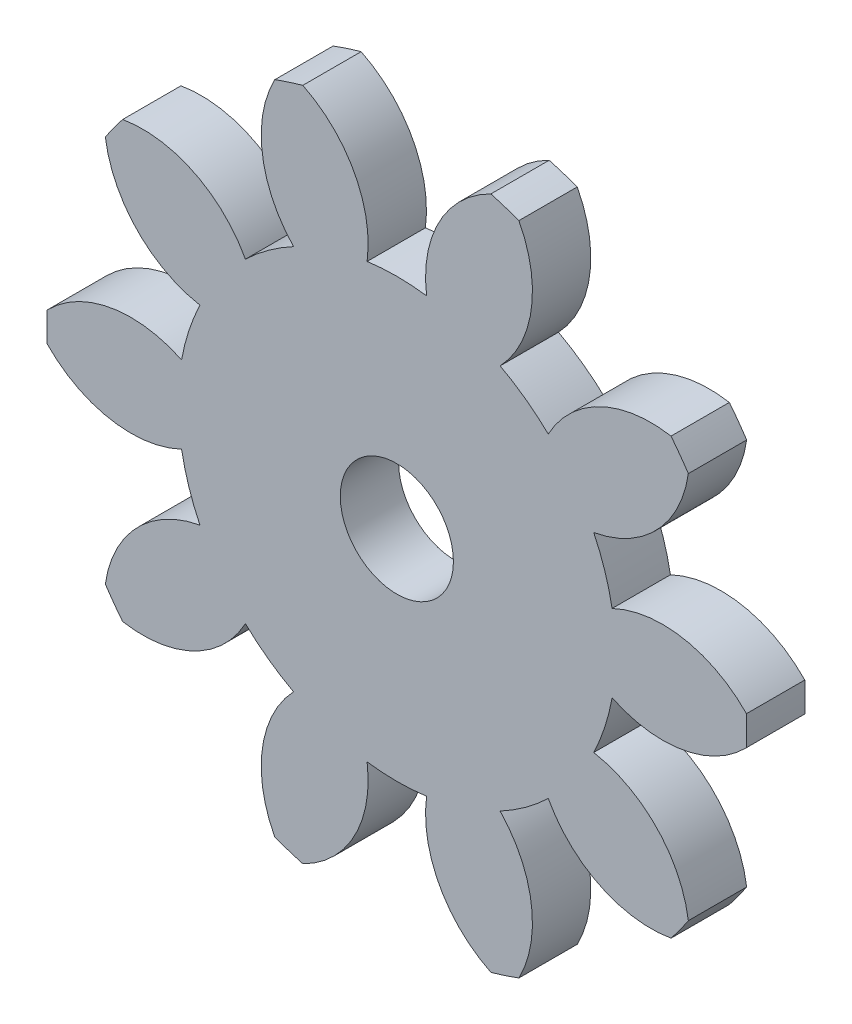
from build123d import *

# Parameters (mm, degrees)
SKETCH1_R           = 18
BOSS_EXTRUDE1_DEPTH = 3
CUT_EXTRUDE1_START  = -3
CUT_EXTRUDE1_DEPTH  = 3
CIRPATTERN1_COUNT   = 10
CUT_EXTRUDE3_DEPTH  = 26.171545449


with BuildPart() as part:
    # Sketch1 → Boss-Extrude1 (new body)
    with BuildSketch(Plane.XY):
        Circle(SKETCH1_R)
    extrude(amount=BOSS_EXTRUDE1_DEPTH)

    # Sketch2 → Cut-Extrude1 (cut)
    with BuildSketch(Plane.XY.offset(3).offset(CUT_EXTRUDE1_START)):
        with BuildLine():
            ThreePointArc((4.836662041, 17.338013159), (2.183107171, 14.775836074), (1.52990268, 11.145487777))
            ThreePointArc((1.52990268, 11.145487777), (0, 11.25), (-1.52990268, 11.145487777))
            ThreePointArc((-1.52990268, 11.145487777), (-2.183107171, 14.775836074), (-4.836662041, 17.338013159))
            ThreePointArc((-4.836662041, 17.338013159), (0, 18), (4.836662041, 17.338013159))
        make_face()
    cut_extrude1 = extrude(amount=CUT_EXTRUDE1_DEPTH, mode=Mode.SUBTRACT)

    # CirPattern1: Cut-Extrude1 ×10 about axis
    cirpattern1_axis = Axis((0, 0, 3), (0, 0, 1))
    for i in range(1, CIRPATTERN1_COUNT):
        add(cut_extrude1.rotate(cirpattern1_axis, i * 360 / CIRPATTERN1_COUNT), mode=Mode.SUBTRACT)

    # Sketch4 → Cut-Extrude3 (cut, through all)
    with BuildSketch(Plane.XY.offset(3)):
        with BuildLine():
            Line((-0.241039416, 2.9), (0.241039416, 2.9))
            ThreePointArc((0.241039416, 2.9), (0, -2.91), (-0.241039416, 2.9))
        make_face()
    extrude(amount=-CUT_EXTRUDE3_DEPTH, mode=Mode.SUBTRACT)


solid = part.part
